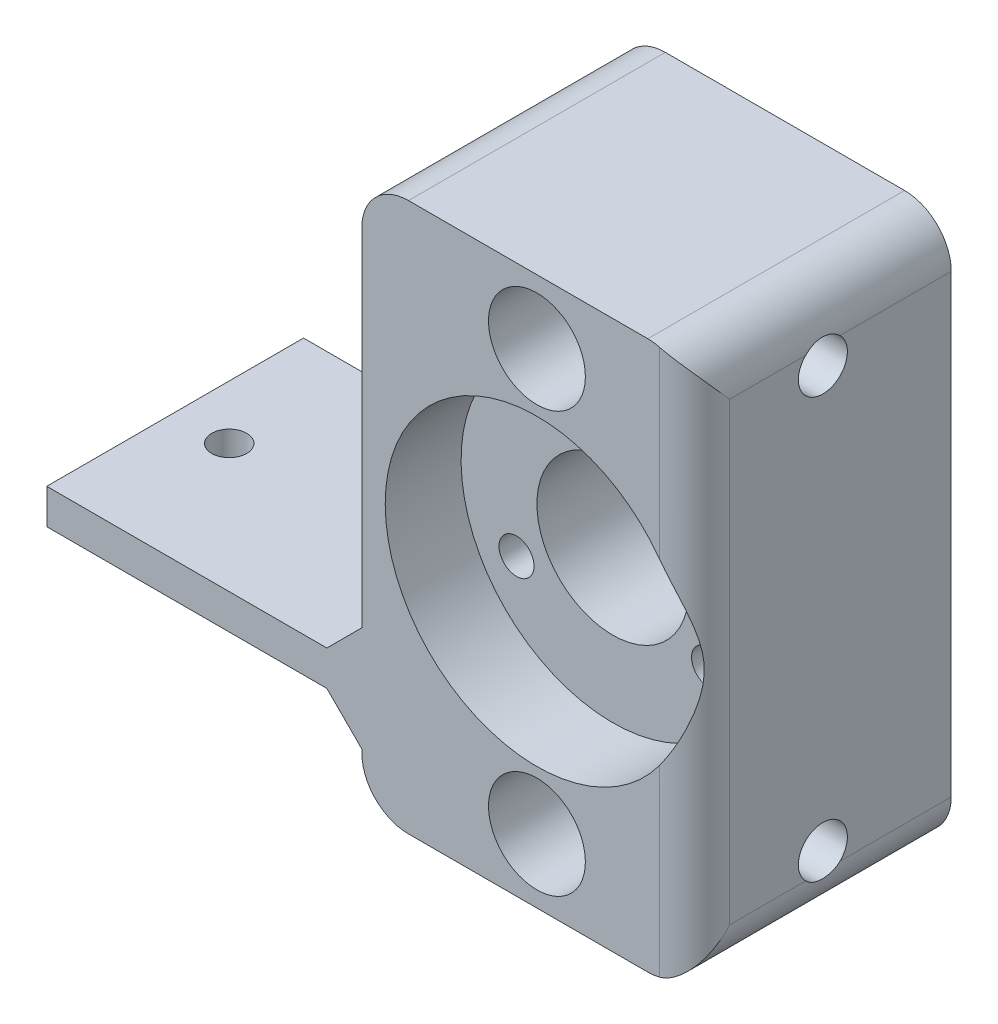
from build123d import *

# Parameters (mm, degrees)
SKETCH1_W           = 28.5
SKETCH1_H           = 47
SKETCH1_R           = 3.65
SKETCH1_R_2         = 13
BOSS_EXTRUDE1_DEPTH = 2
SKETCH1_3_W         = 28.5
SKETCH1_3_H         = 47
SKETCH1_3_R         = 4.15
SKETCH1_3_R_2       = 13
BOSS_EXTRUDE2_DEPTH = 22
SKETCH2_W           = 22
SKETCH2_H           = 3
BOSS_EXTRUDE3_DEPTH = 27
SKETCH1_4_R         = 13
SKETCH1_4_R_2       = 6.5
BOSS_EXTRUDE4_DEPTH = 15.5
SKETCH3_R           = 1.5
CUT_EXTRUDE1_DEPTH  = 51.561843321
CUT_EXTRUDE3_REACH  = 66.16
SKETCH5_R           = 2.1
CUT_EXTRUDE4_REACH  = 71.16
CUT_EXTRUDE4_START  = -5
SKETCH5_3_R         = 2.1
CUT_EXTRUDE5_REACH  = 61.957
SKETCH6_R           = 1.5
CHAMFER1_SIZE       = 3
FILLET1_R           = 4
FILLET2_R           = 3
CUT_EXTRUDE6_DEPTH  = 4


with BuildPart() as part:
    # Sketch1 → Boss-Extrude1 (new body)
    with BuildSketch(Plane.XY):
        with Locations((-0.75, 0)):
            Rectangle(SKETCH1_W, SKETCH1_H)
        with Locations((0, 18)):
            Circle(SKETCH1_R, mode=Mode.SUBTRACT)
        with Locations((0, -18)):
            Circle(SKETCH1_R, mode=Mode.SUBTRACT)
        Circle(SKETCH1_R_2, mode=Mode.SUBTRACT)
    extrude(amount=BOSS_EXTRUDE1_DEPTH)

    # Sketch1<3> → Boss-Extrude2 (add)
    with BuildSketch(Plane.XY):
        with Locations((-0.75, 0)):
            Rectangle(SKETCH1_3_W, SKETCH1_3_H)
        with Locations((0, 18)):
            Circle(SKETCH1_3_R, mode=Mode.SUBTRACT)
        with Locations((0, -18)):
            Circle(SKETCH1_3_R, mode=Mode.SUBTRACT)
        Circle(SKETCH1_3_R_2, mode=Mode.SUBTRACT)
    extrude(amount=BOSS_EXTRUDE2_DEPTH)

    # Sketch2 → Boss-Extrude3 (add)
    with BuildSketch(Plane.ZY.offset(15)):
        with Locations((11, -14.7)):
            Rectangle(SKETCH2_W, SKETCH2_H)
    extrude(amount=BOSS_EXTRUDE3_DEPTH)

    # Sketch1<4> → Boss-Extrude4 (add)
    with BuildSketch(Plane.XY):
        Circle(SKETCH1_4_R)
        Circle(SKETCH1_4_R_2, mode=Mode.SUBTRACT)
    extrude(amount=BOSS_EXTRUDE4_DEPTH)

    # Sketch3 → Cut-Extrude1 (cut, through all)
    with BuildSketch(Plane.XY.offset(15.5)):
        with Locations((0, 9.525)):
            Circle(SKETCH3_R)
        with Locations((8.248891971, -4.7625)):
            Circle(SKETCH3_R)
        with Locations((-8.248891971, -4.7625)):
            Circle(SKETCH3_R)
    extrude(amount=-CUT_EXTRUDE1_DEPTH, mode=Mode.SUBTRACT)

    # Sketch5 → Cut-Extrude3 (cut, up to next)
    with BuildSketch(Plane(origin=(13.5, 0, 0), x_dir=(0, 0, -1), z_dir=(1, 0, 0)), mode=Mode.PRIVATE) as cut_extrude3_sk1:
        with Locations((-11, 18)):
            Circle(SKETCH5_R)
    cut_extrude3_tool1 = extrude(cut_extrude3_sk1.sketch, amount=-CUT_EXTRUDE3_REACH, mode=Mode.PRIVATE) & part.part
    # Sketch5 → Cut-Extrude3 (cut, up to next)
    with BuildSketch(Plane(origin=(13.5, 0, 0), x_dir=(0, 0, -1), z_dir=(1, 0, 0)), mode=Mode.PRIVATE) as cut_extrude3_sk2:
        with Locations((-11, -18)):
            Circle(SKETCH5_R)
    cut_extrude3_tool2 = extrude(cut_extrude3_sk2.sketch, amount=-CUT_EXTRUDE3_REACH, mode=Mode.PRIVATE) & part.part
    add(cut_extrude3_tool1.solids().sort_by_distance((13.5, 18, 11))[0], mode=Mode.SUBTRACT)
    add(cut_extrude3_tool2.solids().sort_by_distance((13.5, -18, 11))[0], mode=Mode.SUBTRACT)

    # Sketch5<3> → Cut-Extrude4 (cut, up to next)
    with BuildSketch(Plane(origin=(13.5, 0, 0), x_dir=(0, 0, -1), z_dir=(1, 0, 0)).offset(CUT_EXTRUDE4_START), mode=Mode.PRIVATE) as cut_extrude4_sk1:
        Polygon((-6.958548116, 18), (-8.979274058, 21.5), (-13.020725942, 21.5), (-15.041451884, 18), (-13.020725942, 14.5), (-8.979274058, 14.5), align=None)
        with Locations((-11, 18)):
            Circle(SKETCH5_3_R, mode=Mode.SUBTRACT)
    cut_extrude4_tool1 = extrude(cut_extrude4_sk1.sketch, amount=-CUT_EXTRUDE4_REACH, mode=Mode.PRIVATE) & part.part
    # Sketch5<3> → Cut-Extrude4 (cut, up to next)
    with BuildSketch(Plane(origin=(13.5, 0, 0), x_dir=(0, 0, -1), z_dir=(1, 0, 0)).offset(CUT_EXTRUDE4_START), mode=Mode.PRIVATE) as cut_extrude4_sk2:
        Polygon((-6.958548116, -18), (-8.979274058, -14.5), (-13.020725942, -14.5), (-15.041451884, -18), (-13.020725942, -21.5), (-8.979274058, -21.5), align=None)
        with Locations((-11, -18)):
            Circle(SKETCH5_3_R, mode=Mode.SUBTRACT)
    cut_extrude4_tool2 = extrude(cut_extrude4_sk2.sketch, amount=-CUT_EXTRUDE4_REACH, mode=Mode.PRIVATE) & part.part
    add(cut_extrude4_tool1.solids().sort_by_distance((8.5, 19.696537, 8.061512))[0], mode=Mode.SUBTRACT)
    add(cut_extrude4_tool2.solids().sort_by_distance((8.5, -16.303463, 8.061512))[0], mode=Mode.SUBTRACT)

    # Sketch6 → Cut-Extrude5 (cut, up to next)
    with BuildSketch(Plane(origin=(0, -13.2, 0), x_dir=(1, 0, 0), z_dir=(0, 1, 0)), mode=Mode.PRIVATE) as cut_extrude5_sk1:
        with Locations(Location((-37.367, -11, 0), (0, 0, 270))):
            Circle(SKETCH6_R)
    cut_extrude5_tool1 = extrude(cut_extrude5_sk1.sketch, amount=-CUT_EXTRUDE5_REACH, mode=Mode.PRIVATE) & part.part
    # Sketch6 → Cut-Extrude5 (cut, up to next)
    with BuildSketch(Plane(origin=(0, -13.2, 0), x_dir=(1, 0, 0), z_dir=(0, 1, 0)), mode=Mode.PRIVATE) as cut_extrude5_sk2:
        with Locations(Location((-23.367, -11, 0), (0, 0, 270))):
            Circle(SKETCH6_R)
    cut_extrude5_tool2 = extrude(cut_extrude5_sk2.sketch, amount=-CUT_EXTRUDE5_REACH, mode=Mode.PRIVATE) & part.part
    add(cut_extrude5_tool1.solids().sort_by_distance((-37.367, -13.2, 11))[0], mode=Mode.SUBTRACT)
    add(cut_extrude5_tool2.solids().sort_by_distance((-23.367, -13.2, 11))[0], mode=Mode.SUBTRACT)

    # Chamfer1
    chamfer1_edges = [part.edges().sort_by_distance(p)[0] for p in [
        (-15, -16.2, 11),
        (-15, -13.2, 11),
    ]]
    chamfer(chamfer1_edges, length=CHAMFER1_SIZE)

    # Fillet1
    # the kernel refuses this fillet: 4 mm, written as the material it takes off along each edge
    with BuildSketch(Plane(origin=(-15, -23.5, 32), x_dir=(0, 1, 0), z_dir=(0, 0, -1)), Plane(origin=(-15, 23.5, 32), x_dir=(1, 0, 0), z_dir=(0, 0, -1))) as fillet1_piece_1:
        with BuildLine():
            CenterArc((FILLET1_R, FILLET1_R), FILLET1_R, 180, 90)
            Line((0, FILLET1_R), (0, 0))
            Line((0, 0), (FILLET1_R, 0))
        make_face()
    extrude(amount=42, mode=Mode.SUBTRACT)
    with BuildSketch(Plane(origin=(13.5, 23.5, -10), x_dir=(0, -1, 0), z_dir=(0, 0, 1)), Plane(origin=(13.5, -23.5, -10), x_dir=(-1, 0, 0), z_dir=(0, 0, 1))) as fillet1_piece_2:
        with BuildLine():
            CenterArc((FILLET1_R, -FILLET1_R), FILLET1_R, 90, 90)
            Line((0, -FILLET1_R), (0, 0))
            Line((0, 0), (FILLET1_R, 0))
        make_face()
    extrude(amount=42, mode=Mode.SUBTRACT)

    # Fillet2
    # the kernel refuses this fillet: 3 mm, written as the material it takes off along each edge
    with BuildSketch(Plane(origin=(13.5, -27, 22), x_dir=(-1, 0, 0), z_dir=(0, 1, 0))) as fillet2_piece_1:
        with BuildLine():
            CenterArc((FILLET2_R, -FILLET2_R), FILLET2_R, 90, 90)
            Line((0, -FILLET2_R), (0, 0))
            Line((0, 0), (FILLET2_R, 0))
        make_face()
    extrude(amount=54, mode=Mode.SUBTRACT)

    # Sketch7 → Cut-Extrude6 (cut)
    with BuildSketch(Plane(origin=(0, 0, 0), x_dir=(-1, 0, 0), z_dir=(0, 0, -1))):
        Polygon((1.58771324, 6.775), (3.175426481, 9.525), (1.58771324, 12.275), (-1.58771324, 12.275), (-3.175426481, 9.525), (-1.58771324, 6.775), align=None)
        Polygon((11.424318452, -4.7625), (9.836605211, -2.0125), (6.661178731, -2.0125), (5.073465491, -4.7625), (6.661178731, -7.5125), (9.836605211, -7.5125), align=None)
        Polygon((-9.836605211, -7.5125), (-6.661178731, -7.5125), (-5.073465491, -4.7625), (-6.661178731, -2.0125), (-9.836605211, -2.0125), (-11.424318452, -4.7625), align=None)
    extrude(amount=-CUT_EXTRUDE6_DEPTH, mode=Mode.SUBTRACT)


solid = part.part
